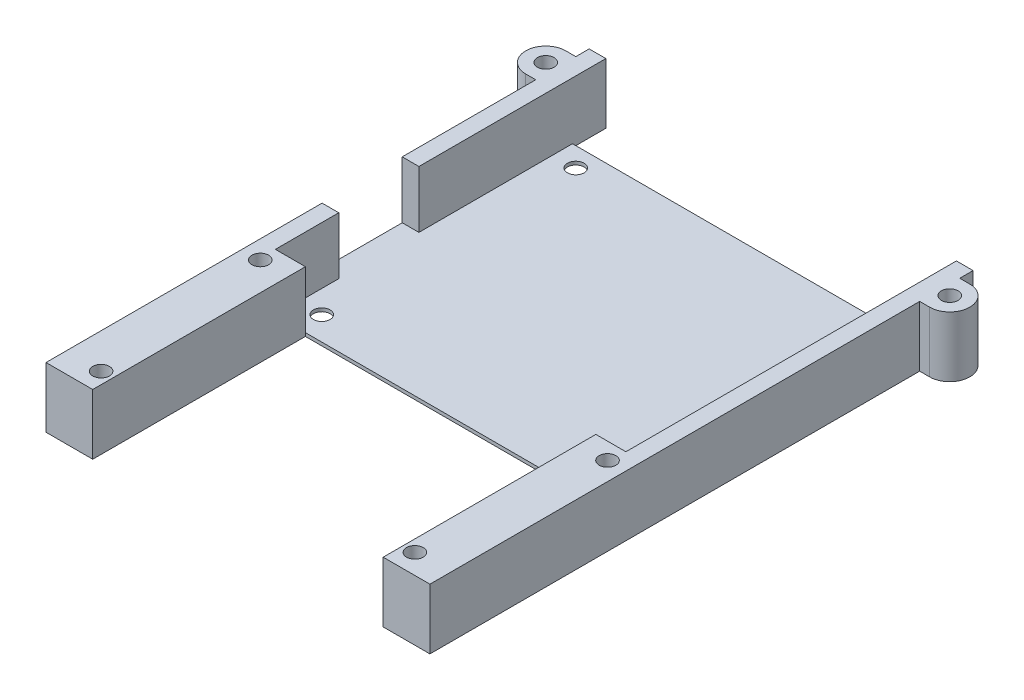
from build123d import *

# Parameters (mm, degrees)
BOSS_EXTRUDE1_DEPTH            = 0.5
BOSS_EXTRUDE2_DEPTH            = 9.05
F_2_5_2_5_DIAMETER_HOLE1_D     = 2.5
F_2_5_2_5_DIAMETER_HOLE1_DEPTH = 12
F_2_5_2_5_DIAMETER_HOLE1_TIP   = 0.751075774


with BuildPart() as part:
    # Sketch1 → Boss-Extrude1 (new body)
    with BuildSketch(Plane(origin=(0, 0, 0), x_dir=(1, 0, 0), z_dir=(0, 1, 0))):
        Polygon((26.25, 31.85), (26.25, 76.35), (-26.25, 76.35), (-26.25, 53.35), (-28.75, 53.35), (-28.75, 41.35), (-26.25, 41.35), (-26.25, 31.85), align=None)
    extrude(amount=BOSS_EXTRUDE1_DEPTH)

    # Sketch1<3> → Boss-Extrude2 (add)
    with BuildSketch(Plane(origin=(0, 0, 0), x_dir=(1, 0, 0), z_dir=(0, 1, 0))):
        with BuildLine():
            Line((-28.75, 81.35), (-28.75, 79.35))
            Line((-28.75, 79.35), (-30.25, 79.35))
            ThreePointArc((-30.25, 79.35), (-33.25, 76.35), (-30.25, 73.35))
            Line((-30.25, 73.35), (-28.75, 73.35))
            Line((-28.75, 73.35), (-28.75, 53.35))
            Line((-28.75, 53.35), (-26.25, 53.35))
            Line((-26.25, 53.35), (-26.25, 81.35))
            Line((-26.25, 81.35), (-28.75, 81.35))
        make_face()
        with BuildLine():
            Line((26.25, 81.35), (26.25, 31.85))
            Line((26.25, 31.85), (21.75, 31.85))
            Line((21.75, 31.85), (21.75, 0))
            Line((21.75, 0), (28.75, 0))
            Line((28.75, 0), (28.75, 73.35))
            Line((28.75, 73.35), (30.25, 73.35))
            ThreePointArc((30.25, 73.35), (33.25, 76.35), (30.25, 79.35))
            Line((30.25, 79.35), (28.75, 79.35))
            Line((28.75, 79.35), (28.75, 81.35))
            Line((28.75, 81.35), (26.25, 81.35))
        make_face()
        Polygon((-26.25, 31.85), (-26.25, 41.35), (-28.75, 41.35), (-28.75, 0), (-21.75, 0), (-21.75, 31.85), align=None)
    extrude(amount=BOSS_EXTRUDE2_DEPTH)

    # Ø2.5 (2.5) Diameter Hole1
    with Locations(Plane(origin=(0, 0, 0), x_dir=(-1, 0, 0), z_dir=(0, -1, 0))):
        with Locations((-22.85, 73.45), (22.85, 73.45), (26, 29.35), (22.85, 35.4), (-22.85, 35.4), (-26, 29.35), (-23.5, 3), (23.5, 3), (-30.25, 76.35), (30.25, 76.35)):
            Hole(F_2_5_2_5_DIAMETER_HOLE1_D / 2, depth=F_2_5_2_5_DIAMETER_HOLE1_DEPTH)
            with Locations((0, 0, -(F_2_5_2_5_DIAMETER_HOLE1_DEPTH + F_2_5_2_5_DIAMETER_HOLE1_TIP / 2))):  # 118° drill point
                Cone(0, F_2_5_2_5_DIAMETER_HOLE1_D / 2, F_2_5_2_5_DIAMETER_HOLE1_TIP, mode=Mode.SUBTRACT)


solid = part.part
